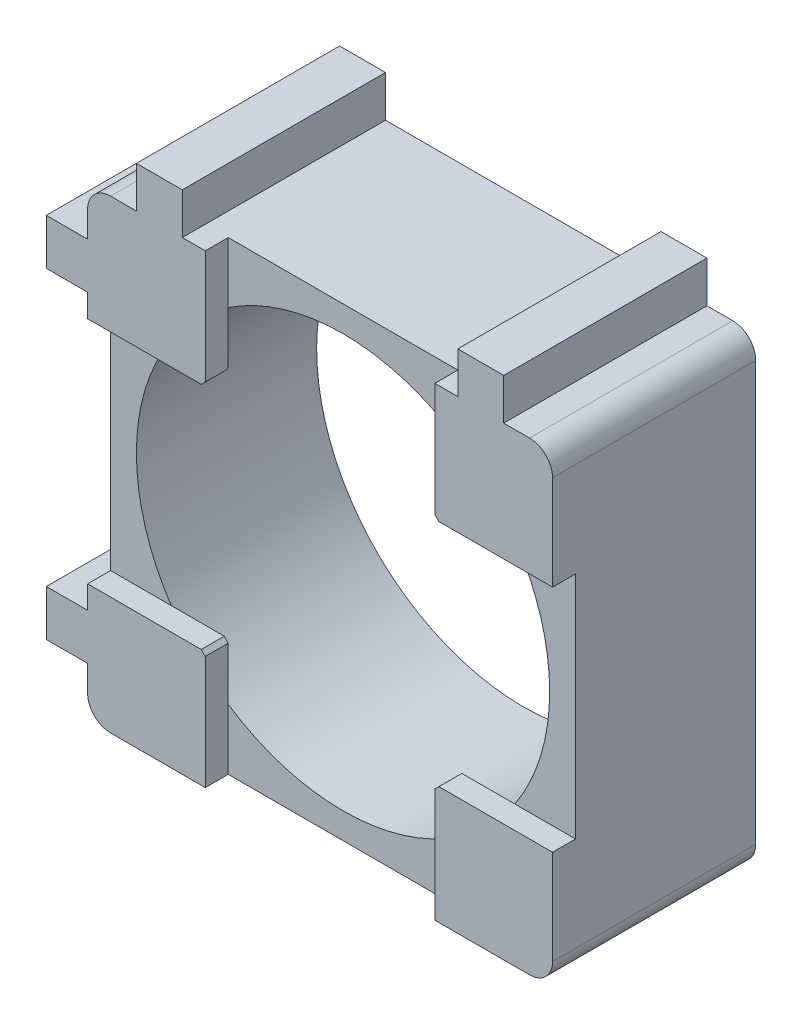
from build123d import *

# Parameters (mm, degrees)
SKETCH1_W           = 20.25
SKETCH1_H           = 20.25
SKETCH1_R           = 9
BOSS_EXTRUDE1_DEPTH = 4.425
BOSS_EXTRUDE2_START = -1
SKETCH2_R           = 9
SKETCH2_R_2         = 7.195345153
BOSS_EXTRUDE2_DEPTH = 1
CUT_EXTRUDE1_START  = -1
CUT_EXTRUDE1_DEPTH  = 1
FILLET1_R           = 1
SKETCH4_W           = 8.85
SKETCH4_H           = 2
BOSS_EXTRUDE3_DEPTH = 1.8
CIRPATTERN1_COUNT   = 2
CIRPATTERN1_ANGLE   = 90


with BuildPart() as part:
    # Sketch1 → Boss-Extrude1 (new, symmetric)
    with BuildSketch(Plane.XY):
        Rectangle(SKETCH1_W, SKETCH1_H)
        Circle(SKETCH1_R, mode=Mode.SUBTRACT)
    extrude(amount=BOSS_EXTRUDE1_DEPTH, both=True)

    # Sketch2 → Boss-Extrude2 (add)
    with BuildSketch(Plane.XY.offset(4.425).offset(BOSS_EXTRUDE2_START)):
        Circle(SKETCH2_R)
        Circle(SKETCH2_R_2, mode=Mode.SUBTRACT)
    extrude(amount=BOSS_EXTRUDE2_DEPTH)

    # Sketch3 → Cut-Extrude1 (cut)
    with BuildSketch(Plane.XY.offset(4.425).offset(CUT_EXTRUDE1_START)):
        with BuildLine():
            Line((-10.125, -5), (-5.174262446, -5))
            ThreePointArc((-5.174262446, -5), (-5.08787735, -5.08787735), (-5, -5.174262446))
            Line((-5, -5.174262446), (-5, -10.125))
            Line((-5, -10.125), (5, -10.125))
            Line((5, -10.125), (5, -5.174262446))
            ThreePointArc((5, -5.174262446), (5.08787735, -5.08787735), (5.174262446, -5))
            Line((5.174262446, -5), (10.125, -5))
            Line((10.125, -5), (10.125, 5))
            Line((10.125, 5), (5.174262446, 5))
            ThreePointArc((5.174262446, 5), (5.08787735, 5.08787735), (5, 5.174262446))
            Line((5, 5.174262446), (5, 10.125))
            Line((5, 10.125), (-5, 10.125))
            Line((-5, 10.125), (-5, 5.174262446))
            ThreePointArc((-5, 5.174262446), (-5.08787735, 5.08787735), (-5.174262446, 5))
            Line((-5.174262446, 5), (-10.125, 5))
            Line((-10.125, 5), (-10.125, -5))
        make_face()
    extrude(amount=CUT_EXTRUDE1_DEPTH, mode=Mode.SUBTRACT)

    # Fillet1
    fillet1_edges = [part.edges().sort_by_distance(p)[0] for p in [
        (-10.125, 10.125, 0),
        (-10.125, -10.125, 0),
        (10.125, 10.125, 0),
        (10.125, -10.125, 0),
    ]]
    fillet(fillet1_edges, radius=FILLET1_R)

    # Sketch4 → Boss-Extrude3 (add)
    with BuildSketch(Plane.ZY.offset(10.125)):
        with Locations((0, 7)):
            Rectangle(SKETCH4_W, SKETCH4_H)
        with Locations((0, -7)):
            Rectangle(SKETCH4_W, SKETCH4_H)
    boss_extrude3 = extrude(amount=BOSS_EXTRUDE3_DEPTH)

    # CirPattern1: Boss-Extrude3 ×2 about axis
    cirpattern1_axis = Axis((0, 0, 4.425), (0, 0, -1))
    for i in range(1, CIRPATTERN1_COUNT):
        add(boss_extrude3.rotate(cirpattern1_axis, i * CIRPATTERN1_ANGLE / (CIRPATTERN1_COUNT - 1)))


solid = part.part
